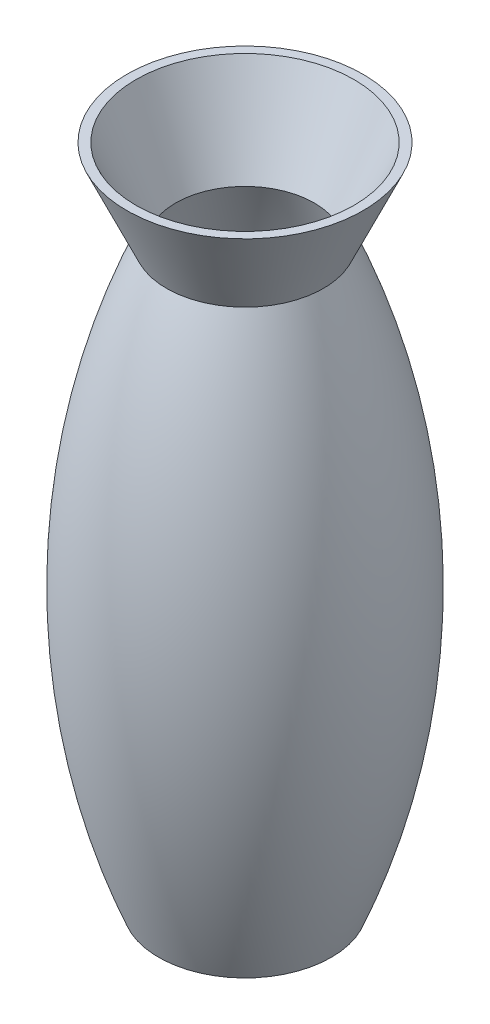
from build123d import *


# Read off the part's stored shape, not the designer's step: Shell1
with BuildPart() as part:
    # Sketch2 → Revolve1 (revolve)
    with BuildSketch(Plane.XY):
        with BuildLine():
            Line((0, 114.791792001), (-36.226923197, 114.791792001))
            Line((-36.226923197, 114.791792001), (-24.070455057, 88.047562095))
            ThreePointArc((-24.070455057, 88.047562095), (-42.977139074, 0.063432784), (-26.501748685, -88.408207999))
            Line((-26.501748685, -88.408207999), (0, -88.408207999))
            Line((0, -88.408207999), (0, 114.791792001))
        make_face()
    revolve(axis=Axis((0, 114.791792001, 0), (0, -1, 0)))

    # Shell1 outline → Shell1 (revolve, cut)
    with BuildSketch(Plane.XY):
        with BuildLine():
            Line((21.28958956, 88.067845354), (33.436838036, 114.791792001))
            Line((33.436838036, 114.791792001), (0, 114.791792001))
            Line((0, 114.791792001), (0, -85.868207999))
            Line((0, -85.868207999), (24.777861268, -85.868207999))
            ThreePointArc((24.777861268, -85.868207999), (40.413359906, 1.448365664), (21.28958956, 88.067845354))
        make_face()
    revolve(axis=Axis((0, 0, 0), (0, 1, 0)), mode=Mode.SUBTRACT)


solid = part.part
